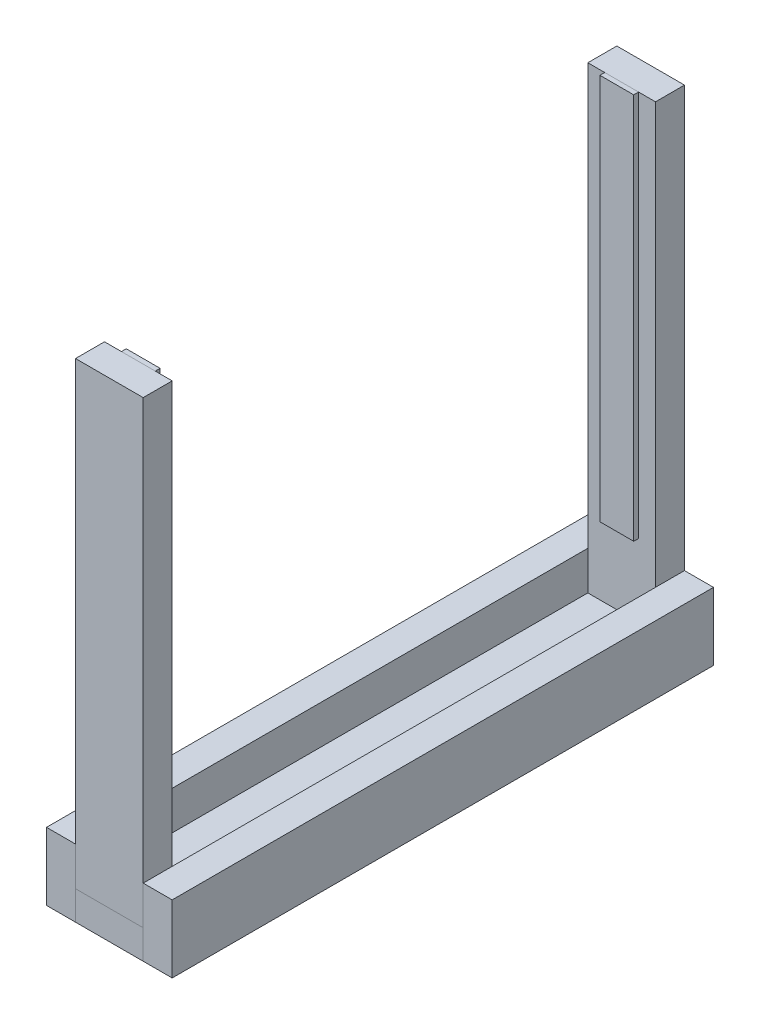
from build123d import *

# Parameters (mm, degrees)
SKETCH1_W             = 88.9
SKETCH1_H             = 711.2
BASE_BOARD_DEPTH      = 38.1
SKETCH2_W             = 88.9
SKETCH2_H             = 38.1
VERTICAL_BOARD_DEPTH  = 603.25
SKETCH3_W             = 711.2
SKETCH3_H             = 88.9
LATERAL_SUPPORT_DEPTH = 38.1
SKETCH4_W             = 44.45
SKETCH4_H             = 508
DRAWER_SLIDE_DEPTH    = 6.35


with BuildPart() as part:
    # Sketch1 → Base Board (new body)
    with BuildSketch(Plane(origin=(0, 0, 0), x_dir=(1, 0, 0), z_dir=(0, 1, 0))):
        Rectangle(SKETCH1_W, SKETCH1_H)
    extrude(amount=BASE_BOARD_DEPTH)


with BuildPart() as body_2:
    # Sketch2 → Vertical Board (new body)
    with BuildSketch(Plane(origin=(0, 38.1, 0), x_dir=(1, 0, 0), z_dir=(0, 1, 0))):
        with Locations((0, -336.55)):
            Rectangle(SKETCH2_W, SKETCH2_H)
    extrude(amount=VERTICAL_BOARD_DEPTH)


with BuildPart() as body_3:
    # Vertical Board Mirror: mirrored copy
    add(body_2.part.mirror(Plane.XY))


with BuildPart() as body_4:
    # Sketch3 → Lateral Support (new body)
    with BuildSketch(Plane(origin=(44.45, 0, 0), x_dir=(0, 0, -1), z_dir=(1, 0, 0))):
        with Locations((0, 44.45)):
            Rectangle(SKETCH3_W, SKETCH3_H)
    extrude(amount=LATERAL_SUPPORT_DEPTH)


with BuildPart() as body_5:
    # Lateral Support Mirror: mirrored copy
    add(body_4.part.mirror(Plane(origin=(0, 0, 0), x_dir=(0, 0, 1), z_dir=(1, 0, 0))))


with BuildPart() as body_6:
    # Sketch4 → Drawer Slide (new body)
    with BuildSketch(Plane(origin=(0, 0, 317.5), x_dir=(-1, 0, 0), z_dir=(0, 0, -1))):
        with Locations((0, 387.35)):
            Rectangle(SKETCH4_W, SKETCH4_H)
    extrude(amount=DRAWER_SLIDE_DEPTH)


with BuildPart() as body_7:
    # Drawer Slide Mirror: mirrored copy
    add(body_6.part.mirror(Plane.XY))


solid = Compound([part.part, body_2.part, body_3.part, body_4.part, body_5.part, body_6.part, body_7.part])
